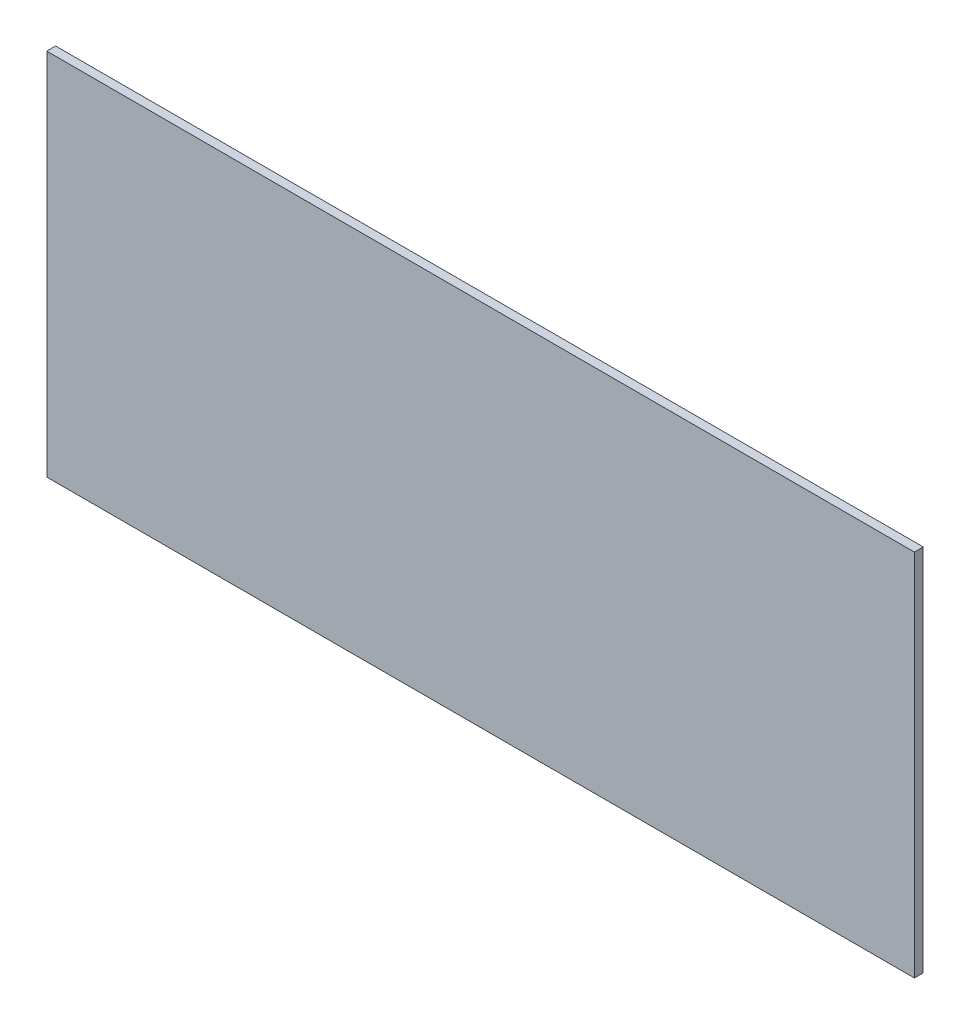
from build123d import *

# Parameters (mm, degrees)
ESBO_O1_W                = 588
ESBO_O1_H                = 250
RESSALTO_EXTRUS_O1_DEPTH = 6


with BuildPart() as part:
    # Esboço1 → Ressalto-extrusão1 (new body)
    with BuildSketch(Plane.XY):
        Rectangle(ESBO_O1_W, ESBO_O1_H)
    extrude(amount=RESSALTO_EXTRUS_O1_DEPTH)


solid = part.part
